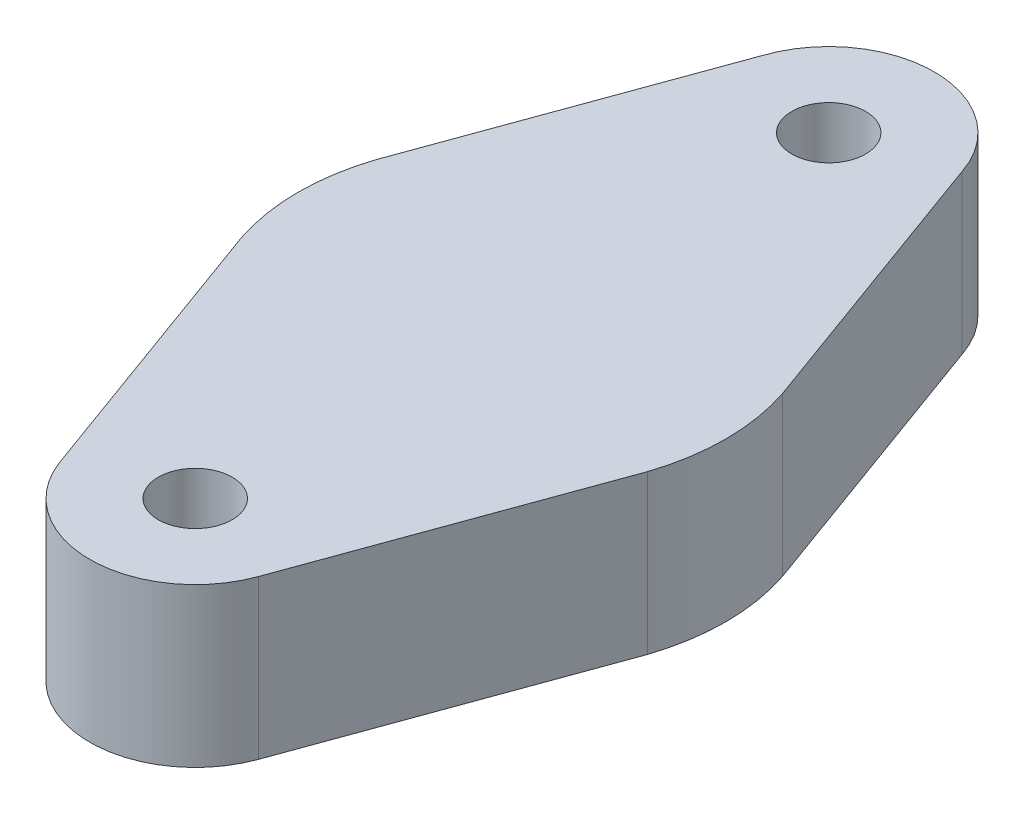
from build123d import *

# Parameters (mm, degrees)
SKETCH_1_R      = 1.4
EXTRUDE_1_DEPTH = 6


with BuildPart() as part:
    # Эскиз1 → Бобышка-Вытянуть1 (new body)
    with BuildSketch(Plane(origin=(0, 0, 0), x_dir=(1, 0, 0), z_dir=(0, 1, 0))):
        with BuildLine():
            Line((7.68660785, -2.554615385), (3.759657266, -13.365641695))
            ThreePointArc((3.759657266, -13.365641695), (0, -16), (-3.759657266, -13.365641695))
            Line((-3.759657266, -13.365641695), (-7.68660785, -2.554615385))
            ThreePointArc((-7.68660785, -2.554615385), (-8.1, 0), (-7.68660785, 2.554615385))
            Line((-7.68660785, 2.554615385), (-3.795855728, 13.261538462))
            ThreePointArc((-3.795855728, 13.261538462), (0, 16), (3.795855728, 13.261538462))
            Line((3.795855728, 13.261538462), (7.68660785, 2.554615385))
            ThreePointArc((7.68660785, 2.554615385), (8.1, 0), (7.68660785, -2.554615385))
        make_face()
        with Locations((0, 12)):
            Circle(SKETCH_1_R, mode=Mode.SUBTRACT)
        with Locations((0, -12)):
            Circle(SKETCH_1_R, mode=Mode.SUBTRACT)
    extrude(amount=EXTRUDE_1_DEPTH)


solid = part.part
